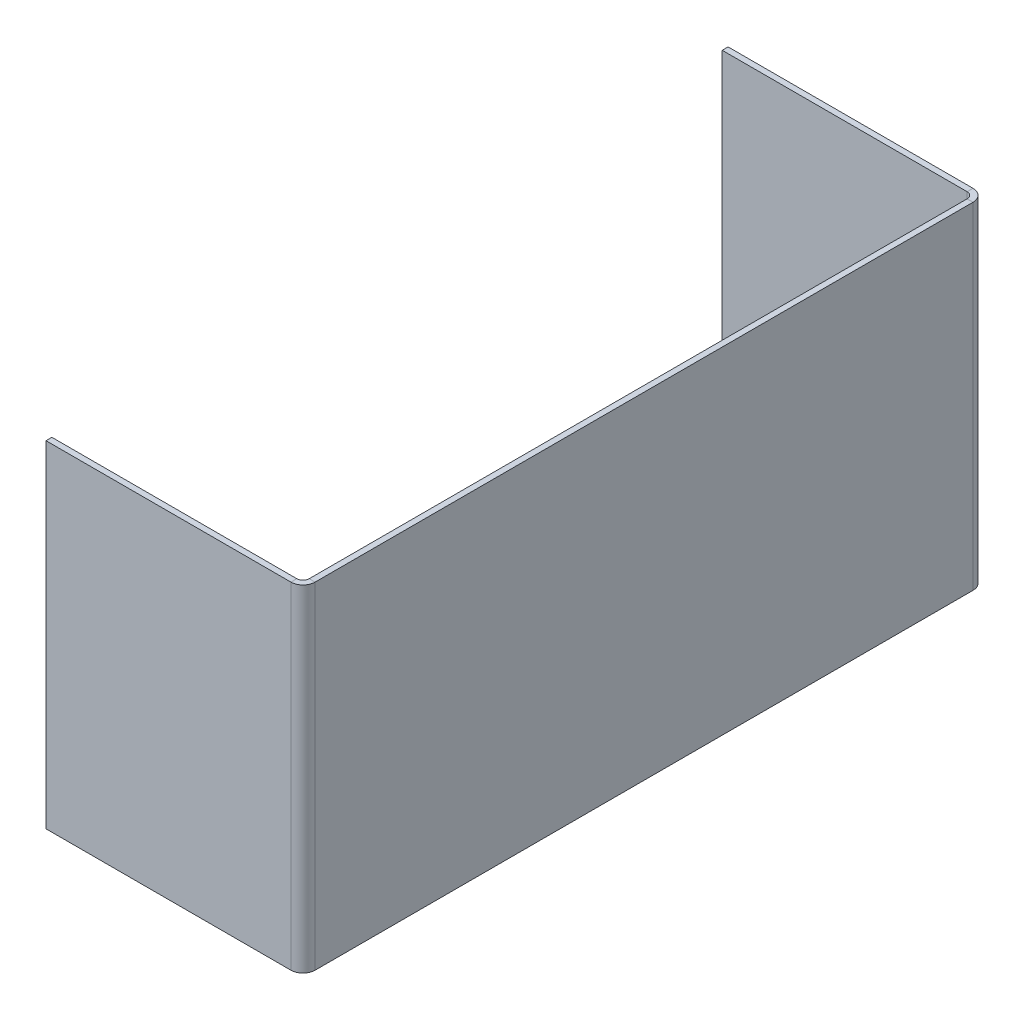
from build123d import *

# Parameters (mm, degrees)
SKETCH1_W              = 140
SKETCH1_H              = 40
BASE_FLANGE1_DEPTH     = 0.7
SKETCHED_BEND1_DEPTH   = 40
SKETCHED_BEND1_2_DEPTH = 40


# Read off the part's stored shape, not the designer's step: Sketched Bend1
# Sheet-metal steps are written as plain solids
with BuildPart() as part:
    # Sketch1 → Base-Flange1 (new body)
    with BuildSketch(Plane.XY):
        with Locations((68.773006135, 20)):
            Rectangle(SKETCH1_W, SKETCH1_H)
    extrude(amount=-BASE_FLANGE1_DEPTH)

    # Sketched Bend1 outline → Sketched Bend1 (cut)
    with BuildSketch(Plane(origin=(0, 0, 0), x_dir=(1, 0, 0), z_dir=(0, 1, 0))):
        with BuildLine():
            ThreePointArc((27.919592491, 0.7), (28.628683458, 0.512803681), (29.152978075, 0))
            Line((29.152978075, 0), (138.773006135, 0))
            Line((138.773006135, 0), (138.773006135, 0.7))
            Line((138.773006135, 0.7), (27.919592491, 0.7))
        make_face()
    extrude(amount=SKETCHED_BEND1_DEPTH, mode=Mode.SUBTRACT)

    # Sketched Bend1 2 outline → Sketched Bend1 2 (add)
    with BuildSketch(Plane(origin=(0, 0, 0), x_dir=(1, 0, 0), z_dir=(0, 1, 0))):
        with BuildLine():
            ThreePointArc((27.919592491, 0), (28.440447346, -0.215745145), (28.656192491, -0.7366))
            Line((28.656192491, -0.7366), (28.656192491, -79.029772711))
            ThreePointArc((28.656192491, -79.029772711), (28.440447346, -79.550627566), (27.919592491, -79.766372711))
            Line((27.919592491, -79.766372711), (-1.226993865, -79.766372711))
            Line((-1.226993865, -79.766372711), (-1.226993865, -80.466372711))
            Line((-1.226993865, -80.466372711), (27.919592491, -80.466372711))
            ThreePointArc((27.919592491, -80.466372711), (28.935422092, -80.045602313), (29.356192491, -79.029772711))
            Line((29.356192491, -79.029772711), (29.356192491, -0.7366))
            ThreePointArc((29.356192491, -0.7366), (29.304457338, -0.354541216), (29.152978075, 0))
            Line((29.152978075, 0), (27.919592491, 0))
        make_face()
    extrude(amount=SKETCHED_BEND1_2_DEPTH)


solid = part.part
